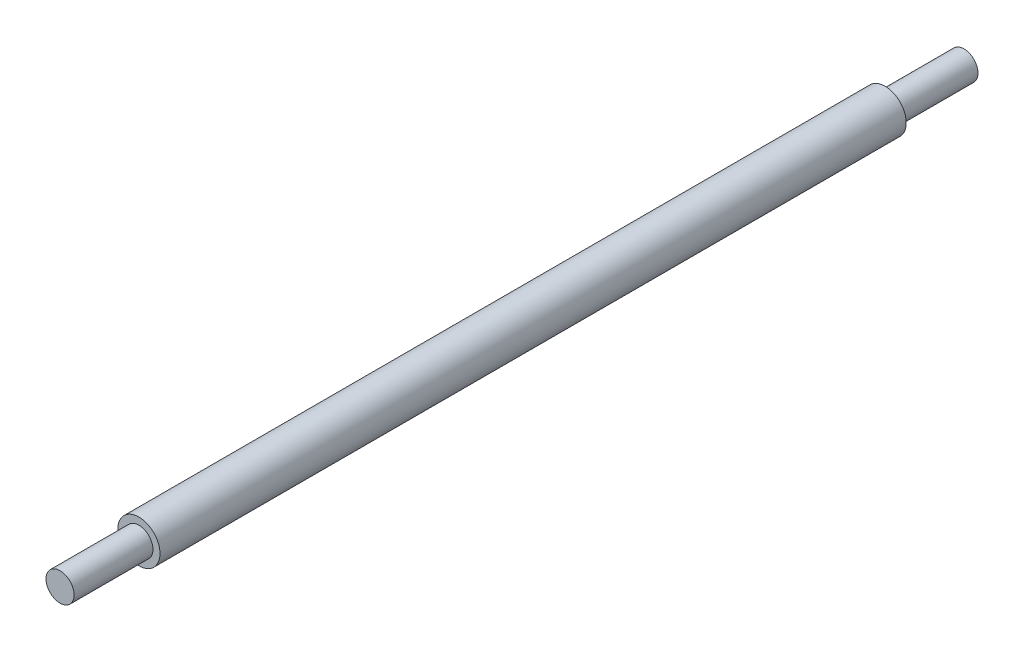
from build123d import *

# Parameters (mm, degrees)
SKETCH1_R           = 9.525
BOSS_EXTRUDE1_DEPTH = 336.55
SKETCH2_R           = 6.35
BOSS_EXTRUDE2_DEPTH = 35.56
BOSS_EXTRUDE3_START = 35.56
SKETCH3_R           = 6.35
BOSS_EXTRUDE3_DEPTH = 35.56


with BuildPart() as part:
    # Sketch1 → Boss-Extrude1 (new body)
    with BuildSketch(Plane.XY):
        Circle(SKETCH1_R)
    extrude(amount=BOSS_EXTRUDE1_DEPTH)

    # Sketch2 → Boss-Extrude2 (add)
    with BuildSketch(Plane.XY.offset(336.55)):
        Circle(SKETCH2_R)
    extrude(amount=BOSS_EXTRUDE2_DEPTH)

    # Sketch3 → Boss-Extrude3 (add)
    with BuildSketch(Plane(origin=(0, 0, 0), x_dir=(-1, 0, 0), z_dir=(0, 0, -1)).offset(BOSS_EXTRUDE3_START)):
        Circle(SKETCH3_R)
    extrude(amount=-BOSS_EXTRUDE3_DEPTH)


solid = part.part
